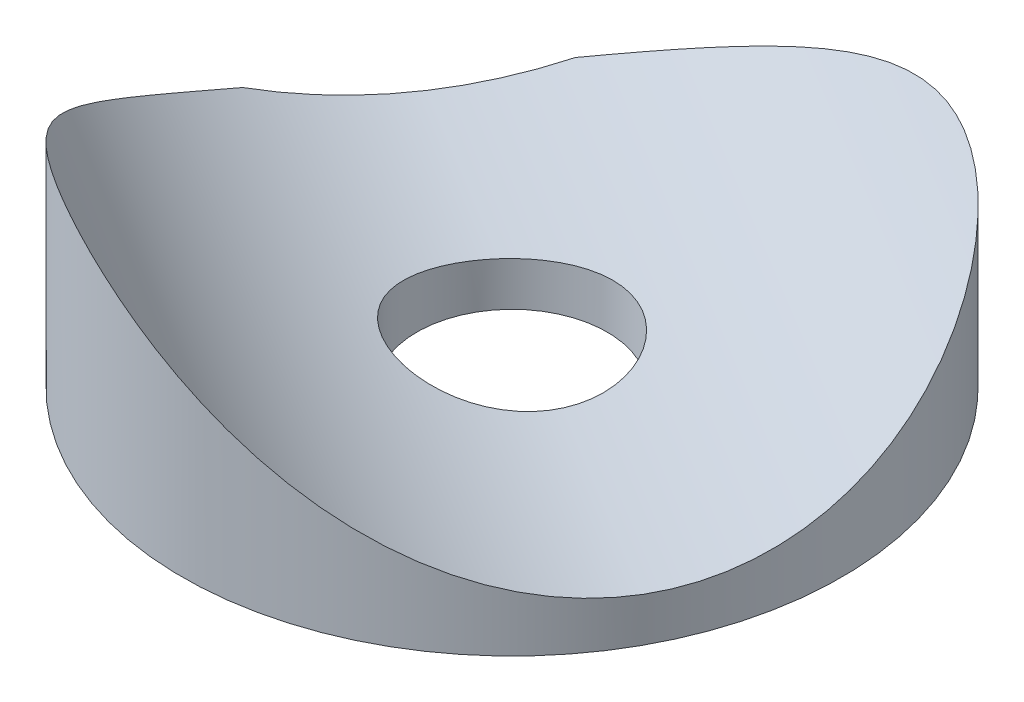
from build123d import *

# Parameters (mm, degrees)
SKETCH2_R                   = 9.525
BOSS_EXTRUDE1_DEPTH         = 1
M5_CLEARANCE_HOLE1_D        = 5.5
BOSS_EXTRUDE2_START         = -1.269999898
BOSS_EXTRUDE2_OUTLINE_R     = 9.525
BOSS_EXTRUDE2_OUTLINE_R_2   = 2.75
BOSS_EXTRUDE2_DEPTH         = 0.269999898
BOSS_EXTRUDE2_START_2       = 1.269999898
BOSS_EXTRUDE2_2_OUTLINE_R   = 9.525
BOSS_EXTRUDE2_2_OUTLINE_R_2 = 2.75
BOSS_EXTRUDE2_2_DEPTH       = 5.2217713
BOSS_EXTRUDE2_START_3       = -11
BOSS_EXTRUDE2_3_DEPTH       = 22
CUT_EXTRUDE1_DEPTH          = 15.546848663
CUT_EXTRUDE1_DEPTH_BACK     = 15.546848663


with BuildPart() as part:
    # Sketch2 → Boss-Extrude1 (new body)
    with BuildSketch(Plane(origin=(0, 0, 0), x_dir=(1, 0, 0), z_dir=(0, 1, 0))):
        with Locations(Location((0, 0, 0), (0, 0, 270))):
            Circle(SKETCH2_R)
    extrude(amount=BOSS_EXTRUDE1_DEPTH)

    # M5 Clearance Hole1 (through all)
    with Locations(Plane(origin=(0, 1, 0), x_dir=(1, 0, 0), z_dir=(0, 1, 0))):
        with Locations((0, 0)):
            Hole(M5_CLEARANCE_HOLE1_D / 2)

    # Boss-Extrude2: read off the stored shape, not the designer's step
    # Boss-Extrude2 outline → Boss-Extrude2 (add)
    with BuildSketch(Plane.XZ.offset(BOSS_EXTRUDE2_START)):
        Circle(BOSS_EXTRUDE2_OUTLINE_R)
        Circle(BOSS_EXTRUDE2_OUTLINE_R_2, mode=Mode.SUBTRACT)
    extrude(amount=BOSS_EXTRUDE2_DEPTH)

    # Boss-Extrude2 2 outline → Boss-Extrude2 2 (add)
    with BuildSketch(Plane(origin=(0, 0, 0), x_dir=(1, 0, 0), z_dir=(0, 1, 0)).offset(BOSS_EXTRUDE2_START_2)):
        Circle(BOSS_EXTRUDE2_2_OUTLINE_R)
        Circle(BOSS_EXTRUDE2_2_OUTLINE_R_2, mode=Mode.SUBTRACT)
    extrude(amount=BOSS_EXTRUDE2_2_DEPTH)

    # Boss-Extrude2 3 outline → Boss-Extrude2 3 (cut)
    with BuildSketch(Plane(origin=(0, 0, 0), x_dir=(0.51884630524159, 0, -0.8548675403459595), z_dir=(0.8548675403459595, 0, 0.5188463052415904)).offset(BOSS_EXTRUDE2_START_3)):
        with BuildLine():
            ThreePointArc((-9.525000037, 6.491771171), (-0.383965362, 1.319816038), (9.525621352, 4.799431821))
            Line((9.525621352, 4.799431821), (11, 6.211953819))
            Line((11, 6.211953819), (11, 6.491771198))
            Line((11, 6.491771198), (-9.525000037, 6.491771171))
        make_face()
    extrude(amount=BOSS_EXTRUDE2_3_DEPTH, mode=Mode.SUBTRACT)

    # Sketch7 → Cut-Extrude1 (cut, two sides: drawn at the far end of the back side and taken through both)
    with BuildSketch(Plane(origin=(0, 1, 0), x_dir=(1, 0, 0), z_dir=(0, 1, 0)).offset(-CUT_EXTRUDE1_DEPTH_BACK)):
        Polygon((-5.757007623, 7.588312608), (-9.388931759, 1.604239825), (-9.95857539, 1.949974666), (-6.326651253, 7.934047449), align=None)
    extrude(amount=CUT_EXTRUDE1_DEPTH + CUT_EXTRUDE1_DEPTH_BACK, mode=Mode.SUBTRACT)


solid = part.part
